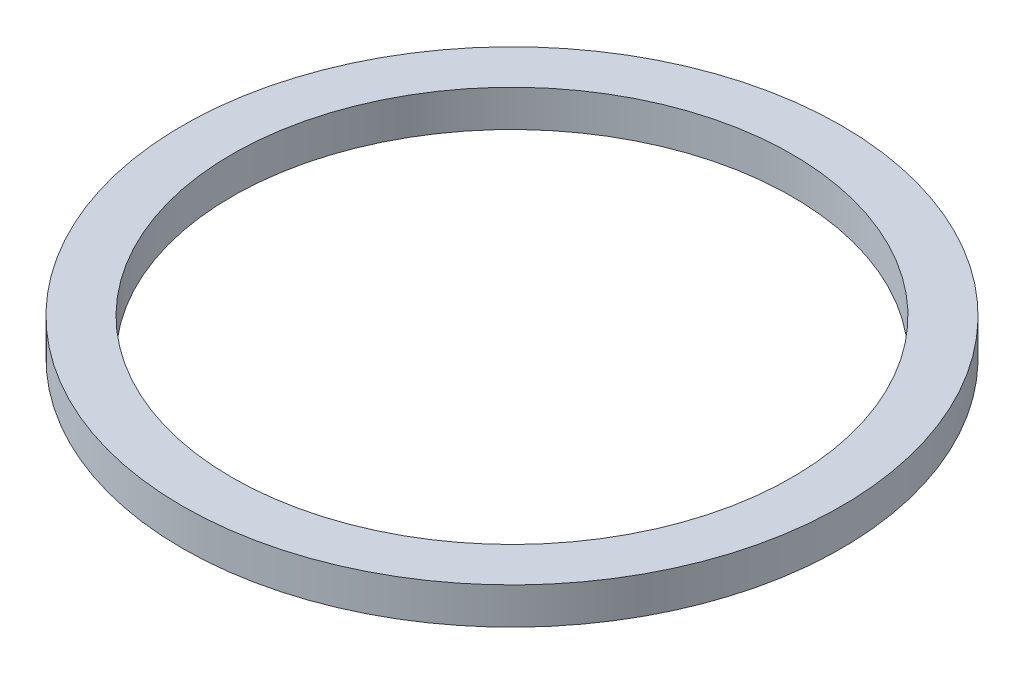
from build123d import *

# Parameters (mm, degrees)
SKETCH1_R           = 15.3
SKETCH1_R_2         = 13
BOSS_EXTRUDE1_DEPTH = 1.7


with BuildPart() as part:
    # Sketch1 → Boss-Extrude1 (new body)
    with BuildSketch(Plane(origin=(0, 0, 0), x_dir=(1, 0, 0), z_dir=(0, 1, 0))):
        Circle(SKETCH1_R)
        Circle(SKETCH1_R_2, mode=Mode.SUBTRACT)
    extrude(amount=BOSS_EXTRUDE1_DEPTH)


solid = part.part
